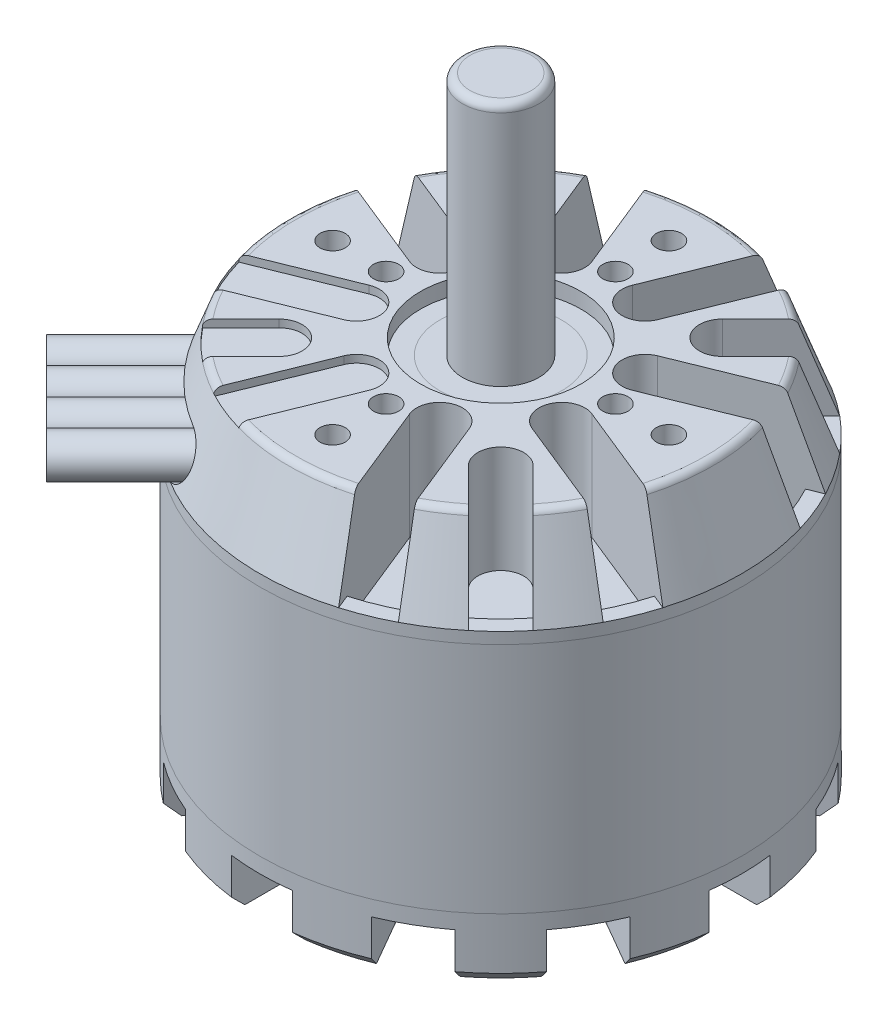
from build123d import *

# Parameters (mm, degrees)
SKETCH1_R             = 31.5
BOSS_EXTRUDE1_DEPTH   = 51.5
SKETCH2_R             = 14
BOSS_EXTRUDE2_DEPTH   = 1.5
M4_TAPPED_HOLE1_D     = 3.3
M4_TAPPED_HOLE1_DEPTH = 11.5
M4_TAPPED_HOLE1_TIP   = 0.991420021
CUT_EXTRUDE1_DEPTH    = 10
BOSS_EXTRUDE3_START   = 3.5
SKETCH7_R             = 31.5
SKETCH7_R_2           = 27
BOSS_EXTRUDE3_DEPTH   = 3.5
FILLET1_R             = 1
SKETCH10_R            = 10.5
CUT_EXTRUDE2_DEPTH    = 2
SKETCH11_R            = 5
BOSS_EXTRUDE5_DEPTH   = 32
FILLET2_R             = 1
M4_TAPPED_HOLE2_D     = 3.3
M4_TAPPED_HOLE2_DEPTH = 5
M4_TAPPED_HOLE2_TIP   = 0.991420021
CUT_EXTRUDE3_START    = -14
CUT_EXTRUDE3_DEPTH    = 14
SKETCH16_R            = 31.5
SKETCH16_R_2          = 29.5
BOSS_EXTRUDE6_DEPTH   = 3
CUT_EXTRUDE4_DEPTH    = 1
CUT_EXTRUDE5_DEPTH    = 40
SKETCH19_R            = 2.5
BOSS_EXTRUDE7_DEPTH   = 45
BOSS_EXTRUDE7_2_DEPTH = 45
BOSS_EXTRUDE7_3_DEPTH = 45
BOSS_EXTRUDE7_4_DEPTH = 45


with BuildPart() as part:
    # Sketch1 → Boss-Extrude1 (new body)
    with BuildSketch(Plane(origin=(0, 0, 0), x_dir=(1, 0, 0), z_dir=(0, 1, 0))):
        Circle(SKETCH1_R)
    extrude(amount=BOSS_EXTRUDE1_DEPTH)

    # Sketch2 → Boss-Extrude2 (add)
    with BuildSketch(Plane.XZ):
        Circle(SKETCH2_R)
    extrude(amount=BOSS_EXTRUDE2_DEPTH)

    # M4 Tapped Hole1
    with Locations(Plane(origin=(0, -1.5, 0), x_dir=(-1, 0, 0), z_dir=(0, -1, 0))):
        with Locations((0, -11), (-11, 0), (0, 11), (11, 0)):
            Hole(M4_TAPPED_HOLE1_D / 2, depth=M4_TAPPED_HOLE1_DEPTH)
            with Locations((0, 0, -(M4_TAPPED_HOLE1_DEPTH + M4_TAPPED_HOLE1_TIP / 2))):  # 118° drill point
                Cone(0, M4_TAPPED_HOLE1_D / 2, M4_TAPPED_HOLE1_TIP, mode=Mode.SUBTRACT)

    # Sketch6 → Cut-Extrude1 (cut)
    with BuildSketch(Plane.XZ):
        with BuildLine():
            Line((-4, 31.2449996), (-4, 18))
            ThreePointArc((-4, 18), (0, 14), (4, 18))
            Line((4, 18), (4, 31.2449996))
            ThreePointArc((4, 31.2449996), (0, 31.5), (-4, 31.2449996))
        make_face()
        with BuildLine():
            Line((-8.035898385, 21.918584287), (-12.158398185, 29.058963395))
            ThreePointArc((-12.158398185, 29.058963395), (-15.75, 27.279800219), (-19.086601415, 25.058963395))
            Line((-19.086601415, 25.058963395), (-14.964101615, 17.918584287))
            ThreePointArc((-14.964101615, 17.918584287), (-9.5, 16.454482672), (-8.035898385, 21.918584287))
        make_face()
        with BuildLine():
            ThreePointArc((19.086601415, 25.058963395), (15.75, 27.279800219), (12.158398185, 29.058963395))
            Line((12.158398185, 29.058963395), (8.035898385, 21.918584287))
            ThreePointArc((8.035898385, 21.918584287), (9.5, 16.454482672), (14.964101615, 17.918584287))
            Line((14.964101615, 17.918584287), (19.086601415, 25.058963395))
        make_face()
        with BuildLine():
            Line((-17.918584287, 14.964101615), (-25.058963395, 19.086601415))
            ThreePointArc((-25.058963395, 19.086601415), (-27.279800219, 15.75), (-29.058963395, 12.158398185))
            Line((-29.058963395, 12.158398185), (-21.918584287, 8.035898385))
            ThreePointArc((-21.918584287, 8.035898385), (-16.454482672, 9.5), (-17.918584287, 14.964101615))
        make_face()
        with BuildLine():
            ThreePointArc((29.058963395, 12.158398185), (27.279800219, 15.75), (25.058963395, 19.086601415))
            Line((25.058963395, 19.086601415), (17.918584287, 14.964101615))
            ThreePointArc((17.918584287, 14.964101615), (16.454482672, 9.5), (21.918584287, 8.035898385))
            Line((21.918584287, 8.035898385), (29.058963395, 12.158398185))
        make_face()
        with BuildLine():
            Line((-18, 4), (-31.2449996, 4))
            ThreePointArc((-31.2449996, 4), (-31.5, 0), (-31.2449996, -4))
            Line((-31.2449996, -4), (-18, -4))
            ThreePointArc((-18, -4), (-14, 0), (-18, 4))
        make_face()
        with BuildLine():
            Line((31.2449996, 4), (18, 4))
            ThreePointArc((18, 4), (14, 0), (18, -4))
            Line((18, -4), (31.2449996, -4))
            ThreePointArc((31.2449996, -4), (31.5, 0), (31.2449996, 4))
        make_face()
        with BuildLine():
            Line((-21.918584287, -8.035898385), (-29.058963395, -12.158398185))
            ThreePointArc((-29.058963395, -12.158398185), (-27.279800219, -15.75), (-25.058963395, -19.086601415))
            Line((-25.058963395, -19.086601415), (-17.918584287, -14.964101615))
            ThreePointArc((-17.918584287, -14.964101615), (-16.454482672, -9.5), (-21.918584287, -8.035898385))
        make_face()
        with BuildLine():
            ThreePointArc((25.058963395, -19.086601415), (27.279800219, -15.75), (29.058963395, -12.158398185))
            Line((29.058963395, -12.158398185), (21.918584287, -8.035898385))
            ThreePointArc((21.918584287, -8.035898385), (16.454482672, -9.5), (17.918584287, -14.964101615))
            Line((17.918584287, -14.964101615), (25.058963395, -19.086601415))
        make_face()
        with BuildLine():
            Line((-14.964101615, -17.918584287), (-19.086601415, -25.058963395))
            ThreePointArc((-19.086601415, -25.058963395), (-15.75, -27.279800219), (-12.158398185, -29.058963395))
            Line((-12.158398185, -29.058963395), (-8.035898385, -21.918584287))
            ThreePointArc((-8.035898385, -21.918584287), (-9.5, -16.454482672), (-14.964101615, -17.918584287))
        make_face()
        with BuildLine():
            ThreePointArc((12.158398185, -29.058963395), (15.75, -27.279800219), (19.086601415, -25.058963395))
            Line((19.086601415, -25.058963395), (14.964101615, -17.918584287))
            ThreePointArc((14.964101615, -17.918584287), (9.5, -16.454482672), (8.035898385, -21.918584287))
            Line((8.035898385, -21.918584287), (12.158398185, -29.058963395))
        make_face()
        with BuildLine():
            Line((-4, -18), (-4, -31.2449996))
            ThreePointArc((-4, -31.2449996), (0, -31.5), (4, -31.2449996))
            Line((4, -31.2449996), (4, -18))
            ThreePointArc((4, -18), (0, -14), (-4, -18))
        make_face()
    extrude(amount=-CUT_EXTRUDE1_DEPTH, mode=Mode.SUBTRACT)

    # Sketch7 → Boss-Extrude3 (add)
    with BuildSketch(Plane.XZ.offset(-10).offset(BOSS_EXTRUDE3_START)):
        Circle(SKETCH7_R)
        Circle(SKETCH7_R_2, mode=Mode.SUBTRACT)
    extrude(amount=-BOSS_EXTRUDE3_DEPTH)

    # Sketch8 → Cut-Revolve1 (revolve, cut)
    with BuildSketch(Plane.XY):
        Polygon((29.75, 0), (31.5, 0), (31.5, 1.75), align=None)
    revolve(axis=Axis((0, 51.5, 0), (0, -1, 0)), mode=Mode.SUBTRACT)

    # Sketch9 → Cut-Revolve2 (revolve, cut)
    with BuildSketch(Plane.XY):
        Polygon((27.5, 51.5), (31.5, 40.5), (31.5, 51.5), align=None)
    revolve(axis=Axis((0, 51.5, 0), (0, -1, 0)), mode=Mode.SUBTRACT)

    # Fillet1
    fillet1_edges = [part.edges().sort_by_distance(p)[0] for p in [
        (-27.5, 51.5, 0),
    ]]
    fillet(fillet1_edges, radius=FILLET1_R)

    # Sketch10 → Cut-Extrude2 (cut)
    with BuildSketch(Plane(origin=(0, 51.5, 0), x_dir=(1, 0, 0), z_dir=(0, 1, 0))):
        Circle(SKETCH10_R)
    extrude(amount=-CUT_EXTRUDE2_DEPTH, mode=Mode.SUBTRACT)

    # Sketch11 → Boss-Extrude5 (add)
    with BuildSketch(Plane(origin=(0, 49.5, 0), x_dir=(1, 0, 0), z_dir=(0, 1, 0))):
        Circle(SKETCH11_R)
    extrude(amount=BOSS_EXTRUDE5_DEPTH)

    # Fillet2
    fillet2_edges = [part.edges().sort_by_distance(p)[0] for p in [
        (-5, 81.5, 0),
    ]]
    fillet(fillet2_edges, radius=FILLET2_R)

    # M4 Tapped Hole2
    with Locations(Plane(origin=(0, 51.5, 0), x_dir=(1, 0, 0), z_dir=(0, 1, 0))):
        with Locations((0, 15), (0, 22), (15, 0), (22, 0), (0, -15), (0, -22), (-15, 0), (-22, 0)):
            Hole(M4_TAPPED_HOLE2_D / 2, depth=M4_TAPPED_HOLE2_DEPTH)
            with Locations((0, 0, -(M4_TAPPED_HOLE2_DEPTH + M4_TAPPED_HOLE2_TIP / 2))):  # 118° drill point
                Cone(0, M4_TAPPED_HOLE2_D / 2, M4_TAPPED_HOLE2_TIP, mode=Mode.SUBTRACT)

    # Sketch15 → Cut-Extrude3 (cut)
    with BuildSketch(Plane(origin=(0, 51.5, 0), x_dir=(1, 0, 0), z_dir=(0, 1, 0)).offset(CUT_EXTRUDE3_START)):
        with BuildLine():
            ThreePointArc((12.374368671, 16.617009358), (12.374368671, 12.374368671), (16.617009358, 12.374368671))
            Line((16.617009358, 12.374368671), (24.293938592, 20.051297905))
            ThreePointArc((24.293938592, 20.051297905), (22.273863607, 22.273863607), (20.051297905, 24.293938592))
            Line((20.051297905, 24.293938592), (12.374368671, 16.617009358))
        make_face()
        with BuildLine():
            ThreePointArc((2.657953683, 14.566581006), (4.313618342, 10.660332865), (8.219866483, 12.315997524))
            Line((8.219866483, 12.315997524), (14.542812299, 27.942022304))
            ThreePointArc((14.542812299, 27.942022304), (11.815563284, 29.200042197), (8.9808995, 30.192605786))
            Line((8.9808995, 30.192605786), (2.657953683, 14.566581006))
        make_face()
        with BuildLine():
            Line((14.566581006, 2.657953683), (30.192605786, 8.9808995))
            ThreePointArc((30.192605786, 8.9808995), (29.200042197, 11.815563284), (27.942022304, 14.542812299))
            Line((27.942022304, 14.542812299), (12.315997524, 8.219866483))
            ThreePointArc((12.315997524, 8.219866483), (10.660332865, 4.313618342), (14.566581006, 2.657953683))
        make_face()
        with BuildLine():
            ThreePointArc((-8.219866483, 12.315997524), (-4.313618342, 10.660332865), (-2.657953683, 14.566581006))
            Line((-2.657953683, 14.566581006), (-8.9808995, 30.192605786))
            ThreePointArc((-8.9808995, 30.192605786), (-11.815563284, 29.200042197), (-14.542812299, 27.942022304))
            Line((-14.542812299, 27.942022304), (-8.219866483, 12.315997524))
        make_face()
        with BuildLine():
            Line((12.315997524, -8.219866483), (27.942022304, -14.542812299))
            ThreePointArc((27.942022304, -14.542812299), (29.200042197, -11.815563284), (30.192605786, -8.9808995))
            Line((30.192605786, -8.9808995), (14.566581006, -2.657953683))
            ThreePointArc((14.566581006, -2.657953683), (10.660332865, -4.313618342), (12.315997524, -8.219866483))
        make_face()
        with BuildLine():
            ThreePointArc((-16.617009358, 12.374368671), (-12.374368671, 12.374368671), (-12.374368671, 16.617009358))
            Line((-12.374368671, 16.617009358), (-20.051297905, 24.293938592))
            ThreePointArc((-20.051297905, 24.293938592), (-22.273863607, 22.273863607), (-24.293938592, 20.051297905))
            Line((-24.293938592, 20.051297905), (-16.617009358, 12.374368671))
        make_face()
        with BuildLine():
            Line((12.374368671, -16.617009358), (20.051297905, -24.293938592))
            ThreePointArc((20.051297905, -24.293938592), (22.273863607, -22.273863607), (24.293938592, -20.051297905))
            Line((24.293938592, -20.051297905), (16.617009358, -12.374368671))
            ThreePointArc((16.617009358, -12.374368671), (12.374368671, -12.374368671), (12.374368671, -16.617009358))
        make_face()
        with BuildLine():
            ThreePointArc((-14.566581006, 2.657953683), (-10.660332865, 4.313618342), (-12.315997524, 8.219866483))
            Line((-12.315997524, 8.219866483), (-27.942022304, 14.542812299))
            ThreePointArc((-27.942022304, 14.542812299), (-29.200042197, 11.815563284), (-30.192605786, 8.9808995))
            Line((-30.192605786, 8.9808995), (-14.566581006, 2.657953683))
        make_face()
        with BuildLine():
            Line((2.657953683, -14.566581006), (8.9808995, -30.192605786))
            ThreePointArc((8.9808995, -30.192605786), (11.815563284, -29.200042197), (14.542812299, -27.942022304))
            Line((14.542812299, -27.942022304), (8.219866483, -12.315997524))
            ThreePointArc((8.219866483, -12.315997524), (4.313618342, -10.660332865), (2.657953683, -14.566581006))
        make_face()
    extrude(amount=CUT_EXTRUDE3_DEPTH, mode=Mode.SUBTRACT)

    # Sketch16 → Boss-Extrude6 (add)
    with BuildSketch(Plane(origin=(0, 37.5, 0), x_dir=(1, 0, 0), z_dir=(0, 1, 0))):
        Circle(SKETCH16_R)
        Circle(SKETCH16_R_2, mode=Mode.SUBTRACT)
    extrude(amount=BOSS_EXTRUDE6_DEPTH)

    # Sketch15<3> → Cut-Extrude4 (cut)
    with BuildSketch(Plane(origin=(0, 51.5, 0), x_dir=(1, 0, 0), z_dir=(0, 1, 0))):
        with BuildLine():
            Line((-24.437875634, -13.124887406), (-12.315997524, -8.219866483))
            ThreePointArc((-12.315997524, -8.219866483), (-10.660332865, -4.313618342), (-14.566581006, -2.657953683))
            Line((-14.566581006, -2.657953683), (-26.688459116, -7.562974606))
            ThreePointArc((-26.688459116, -7.562974606), (-25.713989281, -10.404959882), (-24.437875634, -13.124887406))
        make_face()
        with BuildLine():
            Line((-8.219866483, -12.315997524), (-13.124887406, -24.437875634))
            ThreePointArc((-13.124887406, -24.437875634), (-10.404959882, -25.713989281), (-7.562974606, -26.688459116))
            Line((-7.562974606, -26.688459116), (-2.657953683, -14.566581006))
            ThreePointArc((-2.657953683, -14.566581006), (-4.313618342, -10.660332865), (-8.219866483, -12.315997524))
        make_face()
        with BuildLine():
            Line((-17.378326254, -21.620966942), (-12.374368671, -16.617009358))
            ThreePointArc((-12.374368671, -16.617009358), (-12.374368671, -12.374368671), (-16.617009358, -12.374368671))
            Line((-16.617009358, -12.374368671), (-21.620966942, -17.378326254))
            ThreePointArc((-21.620966942, -17.378326254), (-19.614693917, -19.614693917), (-17.378326254, -21.620966942))
        make_face()
    extrude(amount=-CUT_EXTRUDE4_DEPTH, mode=Mode.SUBTRACT)

    # Sketch18 → Cut-Extrude5 (cut)
    with BuildSketch(Plane(origin=(2.121320344, 0, -2.121320344), x_dir=(0.7071067811865462, 0, 0.7071067811865488), z_dir=(-0.7071067811865488, 0, 0.7071067811865462))):
        with BuildLine():
            Line((7, 46.5), (-7, 46.5))
            ThreePointArc((-7, 46.5), (-10, 43.5), (-7, 40.5))
            Line((-7, 40.5), (7, 40.5))
            ThreePointArc((7, 40.5), (10, 43.5), (7, 46.5))
        make_face()
    extrude(amount=CUT_EXTRUDE5_DEPTH, mode=Mode.SUBTRACT)


with BuildPart() as body_2:
    # Sketch19 → Boss-Extrude7 (new body)
    with BuildSketch(Plane(origin=(2.121320344, 0, -2.121320344), x_dir=(0.7071067811865464, 0, 0.7071067811865488), z_dir=(-0.7071067811865488, 0, 0.7071067811865464))):
        with Locations((-7.5, 43.5)):
            Circle(SKETCH19_R)
    extrude(amount=BOSS_EXTRUDE7_DEPTH)


with BuildPart() as body_3:
    # Sketch19 → Boss-Extrude7 2 (new body)
    with BuildSketch(Plane(origin=(2.121320344, 0, -2.121320344), x_dir=(0.7071067811865464, 0, 0.7071067811865488), z_dir=(-0.7071067811865488, 0, 0.7071067811865464))):
        with Locations((7.5, 43.5)):
            Circle(SKETCH19_R)
    extrude(amount=BOSS_EXTRUDE7_2_DEPTH)


with BuildPart() as body_4:
    # Sketch19 → Boss-Extrude7 3 (new body)
    with BuildSketch(Plane(origin=(2.121320344, 0, -2.121320344), x_dir=(0.7071067811865464, 0, 0.7071067811865488), z_dir=(-0.7071067811865488, 0, 0.7071067811865464))):
        with BuildLine():
            ThreePointArc((5, 43.5), (2.5, 46), (0, 43.5))
            ThreePointArc((0, 43.5), (2.5, 41), (5, 43.5))
        make_face()
    extrude(amount=BOSS_EXTRUDE7_3_DEPTH)


with BuildPart() as body_5:
    # Sketch19 → Boss-Extrude7 4 (new body)
    with BuildSketch(Plane(origin=(2.121320344, 0, -2.121320344), x_dir=(0.7071067811865464, 0, 0.7071067811865488), z_dir=(-0.7071067811865488, 0, 0.7071067811865464))):
        with BuildLine():
            ThreePointArc((0, 43.5), (-2.5, 46), (-5, 43.5))
            ThreePointArc((-5, 43.5), (-2.5, 41), (0, 43.5))
        make_face()
    extrude(amount=BOSS_EXTRUDE7_4_DEPTH)


solid = Compound([part.part, body_2.part, body_3.part, body_4.part, body_5.part])
